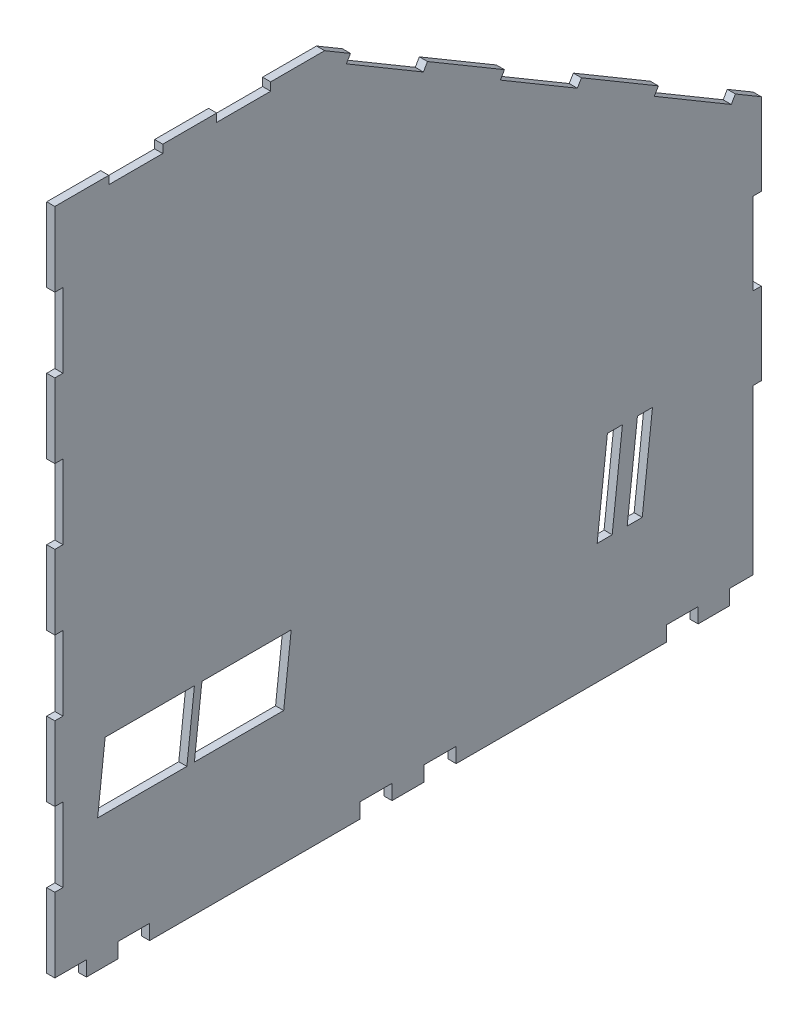
from build123d import *

# Parameters (mm, degrees)
BOSS_EXTRUDE1_DEPTH = 2.7


with BuildPart() as part:
    # Sketch1 → Boss-Extrude1 (new body)
    with BuildSketch(Plane(origin=(0, 0, 0), x_dir=(0, 0, -1), z_dir=(1, 0, 0))):
        Polygon((117.52, -0.68), (117.52, 26.6), (108.912256818, 31.689868103), (107.53799243, 29.365777444), (81.927089703, 44.509830203), (83.301354091, 46.833920862), (57.690451364, 61.977973621), (56.316186976, 59.653882961), (30.705284249, 74.79793572), (32.079548636, 77.122026379), (6.468645909, 92.266079138), (5.094381521, 89.941988479), (-20.516521206, 105.086041238), (-19.142256818, 107.410131897), (-27.75, 112.5), (-45.704, 112.5), (-45.704, 109.8), (-63.658, 109.8), (-63.658, 112.5), (-81.612, 112.5), (-81.612, 109.8), (-99.566, 109.8), (-99.566, 112.5), (-117.52, 112.5), (-117.52, 87.8), (-114.82, 87.8), (-114.82, 63.1), (-117.52, 63.1), (-117.52, 38.4), (-114.82, 38.4), (-114.82, 13.7), (-117.52, 13.7), (-117.52, -11), (-114.82, -11), (-114.82, -35.7), (-117.52, -35.7), (-117.52, -60.4), (-114.82, -60.4), (-114.82, -85.1), (-117.52, -85.1), (-117.52, -109.8), (-107.013333333, -109.8), (-107.013333333, -112.5), (-107.013333333, -114.8), (-96.506666667, -114.8), (-96.506666667, -112.5), (-96.506666667, -109.8), (-86, -109.8), (-86, -112.5), (-86, -114.8), (-16, -114.8), (-16, -112.5), (-16, -109.8), (-5.333333333, -109.8), (-5.333333333, -112.5), (-5.333333333, -114.8), (5.333333333, -114.8), (5.333333333, -112.5), (5.333333333, -109.8), (16, -109.8), (16, -112.5), (16, -114.8), (86, -114.8), (86, -112.5), (86, -109.8), (96.506666667, -109.8), (96.506666667, -112.5), (96.506666667, -114.8), (107.013333333, -114.8), (107.013333333, -112.5), (107.013333333, -109.8), (114.82, -109.8), (114.82, -82.52), (114.82, -55.24), (117.52, -55.24), (117.52, -27.96), (114.82, -27.96), (114.82, -0.68), align=None)
        Polygon((71.32, -44.8), (66.32, -44.8), (62.910909091, -74.8), (67.910909091, -74.8), align=None, mode=Mode.SUBTRACT)
        Polygon((72.910909091, -74.8), (76.32, -44.8), (81.32, -44.8), (77.910909091, -74.8), align=None, mode=Mode.SUBTRACT)
        Polygon((-68.58, -48.8), (-41.38, -48.8), (-38.88, -48.8), (-41.38, -70.8), (-71.08, -70.8), align=None, mode=Mode.SUBTRACT)
        Polygon((-100.78, -48.8), (-103.28, -70.8), (-100.78, -70.8), (-73.58, -70.8), (-71.08, -48.8), align=None, mode=Mode.SUBTRACT)
    extrude(amount=BOSS_EXTRUDE1_DEPTH)


solid = part.part
